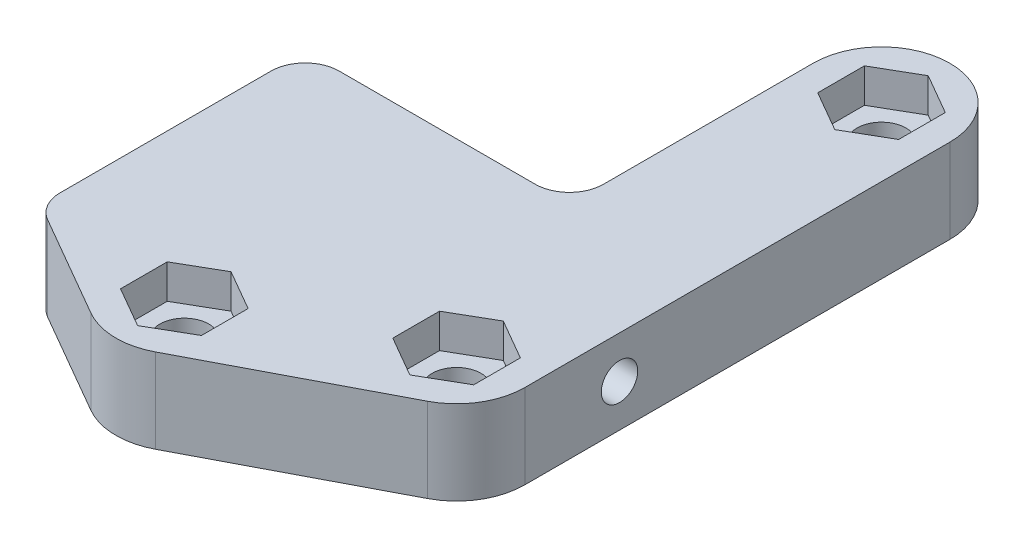
from build123d import *

# Parameters (mm, degrees)
SKETCH2_R               = 2.15
BOSS_EXTRUDE1_DEPTH     = 7.4
CUT_EXTRUDE4_DEPTH      = 49.713080647
CUT_EXTRUDE4_DEPTH_BACK = 49.713080647
SKETCH3_R               = 1.6
CUT_EXTRUDE1_DEPTH      = 3
CUT_EXTRUDE5_DEPTH      = 41.060132627
FILLET1_R               = 3


with BuildPart() as part:
    # Sketch2 → Boss-Extrude1 (new body)
    with BuildSketch(Plane(origin=(0, 0, 0), x_dir=(1, 0, 0), z_dir=(0, 1, 0))):
        with BuildLine():
            Line((-13.5, -25.984609691), (-3, -32.046787517))
            ThreePointArc((-3, -32.046787517), (-0.126819274, -32.849294684), (2.777711124, -32.168935661))
            Line((2.777711124, -32.168935661), (18.477711124, -23.968935661))
            ThreePointArc((18.477711124, -23.968935661), (20.831581956, -21.759793603), (21.7, -18.650635095))
            Line((21.7, -18.650635095), (21.7, 18.650635095))
            ThreePointArc((21.7, 18.650635095), (19.942640687, 22.893275782), (15.7, 24.650635095))
            Line((15.7, 24.650635095), (11.5, 24.650635095))
            Line((11.5, 24.650635095), (-13.5, 24.650635095))
            Line((-13.5, 24.650635095), (-13.5, -22.650635095))
            Line((-13.5, -22.650635095), (-13.5, -25.984609691))
        make_face()
        with Locations((0, -26.850635095)):
            Circle(SKETCH2_R, mode=Mode.SUBTRACT)
        with Locations((15.7, -18.650635095)):
            Circle(SKETCH2_R, mode=Mode.SUBTRACT)
        with Locations((15.7, 18.650635095)):
            Circle(SKETCH2_R, mode=Mode.SUBTRACT)
    extrude(amount=BOSS_EXTRUDE1_DEPTH)

    # Sketch3 → Cut-Extrude4 (cut, two sides: drawn at the far end of the back side and taken through both)
    with BuildSketch(Plane.ZY.offset(-21.7).offset(-CUT_EXTRUDE4_DEPTH_BACK)):
        with Locations((10.349364905, 3.7)):
            Circle(SKETCH3_R)
    extrude(amount=CUT_EXTRUDE4_DEPTH + CUT_EXTRUDE4_DEPTH_BACK, mode=Mode.SUBTRACT)

    # Sketch4 → Cut-Extrude1 (cut)
    with BuildSketch(Plane.XZ.offset(-7.4)):
        Polygon((0, 22.751448183), (3.55, 24.801041639), (3.55, 28.90022855), (0, 30.949822006), (-3.55, 28.90022855), (-3.55, 24.801041639), align=None)
        Polygon((15.7, 14.551448183), (19.25, 16.601041639), (19.25, 20.70022855), (15.7, 22.749822006), (12.15, 20.70022855), (12.15, 16.601041639), align=None)
        Polygon((12.15, -20.70022855), (15.7, -22.749822006), (19.25, -20.70022855), (19.25, -16.601041639), (15.7, -14.551448183), (12.15, -16.601041639), align=None)
    extrude(amount=CUT_EXTRUDE1_DEPTH, mode=Mode.SUBTRACT)

    # Sketch5 → Cut-Extrude5 (cut, through all)
    with BuildSketch(Plane(origin=(0, 7.4, 0), x_dir=(1, 0, 0), z_dir=(0, 1, 0))):
        with BuildLine():
            Line((15.7, 24.650635095), (-13.5, 24.650635095))
            Line((-13.5, 24.650635095), (-13.5, -2.749364905))
            Line((-13.5, -2.749364905), (9.7, -2.749364905))
            Line((9.7, -2.749364905), (9.7, 18.650635095))
            ThreePointArc((9.7, 18.650635095), (11.457359313, 22.893275782), (15.7, 24.650635095))
        make_face()
    extrude(amount=-CUT_EXTRUDE5_DEPTH, mode=Mode.SUBTRACT)

    # Fillet1
    fillet1_edges = [part.edges().sort_by_distance(p)[0] for p in [
        (-13.5, 3.7, 25.984609691),
        (9.7, 3.7, 2.749364905),
        (-13.5, 3.7, 2.749364905),
    ]]
    fillet(fillet1_edges, radius=FILLET1_R)


solid = part.part
